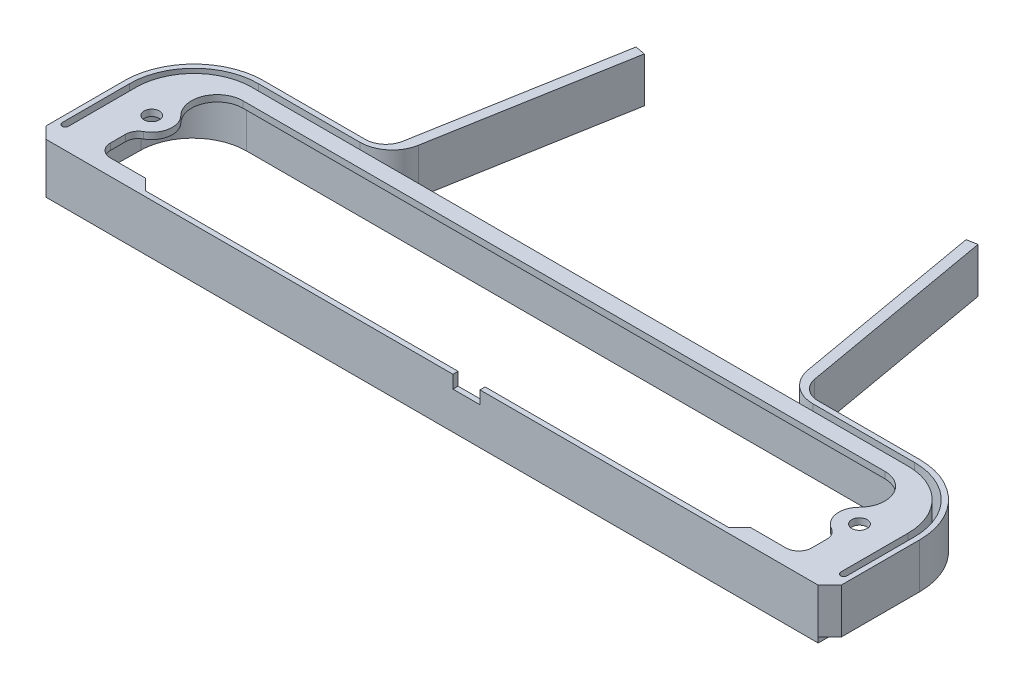
from build123d import *
from build123d.topology import SkipClean

# Parameters (mm, degrees)
SKETCH1_R               = 1.2
BOSS_EXTRUDE1_DEPTH     = 1
BOSS_EXTRUDE2_START     = 7.2
BOSS_EXTRUDE2_DEPTH     = 8.2
CHAMFER1_SIZE           = 1
CUT_EXTRUDE1_DEPTH      = 65.659415401
CUT_EXTRUDE1_DEPTH_BACK = 65.659415401
CUT_EXTRUDE2_REACH      = 66.659
SKETCH11_W              = 4.2
SKETCH11_H              = 2
FILLET1_R               = 2
CHAMFER2_SIZE           = 1.7
BOSS_EXTRUDE3_START     = 1
BOSS_EXTRUDE3_DEPTH     = 7


with BuildPart() as part:
    # Sketch1 → Boss-Extrude1 (new body)
    with BuildSketch(Plane(origin=(0, 0, 0), x_dir=(1, 0, 0), z_dir=(0, 1, 0))):
        with BuildLine():
            Line((-60, 0), (-54.5, 0))
            Line((-54.5, 0), (54.5, 0))
            Line((54.5, 0), (60, 0))
            Line((60, 0), (60, 14))
            ThreePointArc((60, 14), (57.363961031, 20.363961031), (51, 23))
            Line((51, 23), (-51, 23))
            ThreePointArc((-51, 23), (-57.363961031, 20.363961031), (-60, 14))
            Line((-60, 14), (-60, 0))
        make_face()
        with Locations(Location((55, 11.43, 0), (0, 0, 270))):
            Circle(SKETCH1_R, mode=Mode.SUBTRACT)
        with Locations(Location((-55, 11.43, 0), (0, 0, 270))):
            Circle(SKETCH1_R, mode=Mode.SUBTRACT)
        with BuildLine():
            Line((-49.887750006, 20.5), (49.887750006, 20.5))
            ThreePointArc((49.887750006, 20.5), (53.580084408, 18.038397435), (52.727888892, 13.683333333))
            ThreePointArc((52.727888892, 13.683333333), (51.958770192, 10.434549723), (54.5, 8.269303874))
            Line((54.5, 8.269303874), (54.5, 2.5))
            Line((54.5, 2.5), (47, 2.5))
            Line((47, 2.5), (47, 0.8))
            Line((47, 0.8), (-47, 0.8))
            Line((-47, 0.8), (-47, 2.5))
            Line((-47, 2.5), (-54.5, 2.5))
            Line((-54.5, 2.5), (-54.5, 8.269303874))
            ThreePointArc((-54.5, 8.269303874), (-51.958770192, 10.434549723), (-52.727888892, 13.683333333))
            ThreePointArc((-52.727888892, 13.683333333), (-53.580084408, 18.038397435), (-49.887750006, 20.5))
        make_face(mode=Mode.SUBTRACT)
    extrude(amount=BOSS_EXTRUDE1_DEPTH)

    # Sketch8 → Boss-Extrude2 (add)
    with SkipClean():  # the faces are left unmerged after this step: merging them gives an invalid solid
        with BuildSketch(Plane(origin=(0, 0, 0), x_dir=(-1, 0, 0), z_dir=(0, -1, 0)).offset(BOSS_EXTRUDE2_START)):
            with BuildLine():
                Line((60, 0), (60, 14))
                ThreePointArc((60, 14), (57.363961031, 20.363961031), (51, 23))
                Line((51, 23), (-51, 23))
                ThreePointArc((-51, 23), (-57.363961031, 20.363961031), (-60, 14))
                Line((-60, 14), (-60, 0))
                Line((-60, 0), (60, 0))
            make_face()
            with BuildLine():
                Line((-59.2, 0.8), (59.2, 0.8))
                Line((59.2, 0.8), (59.2, 14))
                ThreePointArc((59.2, 14), (56.798275606, 19.798275606), (51, 22.2))
                Line((51, 22.2), (-51, 22.2))
                ThreePointArc((-51, 22.2), (-56.798275606, 19.798275606), (-59.2, 14))
                Line((-59.2, 14), (-59.2, 0.8))
            make_face(mode=Mode.SUBTRACT)
        extrude(amount=-BOSS_EXTRUDE2_DEPTH)
    add(part.part.scale(1), mode=Mode.REPLACE)  # the faces are merged on a copy

    # Chamfer1
    chamfer1_edges = [part.edges().sort_by_distance(p)[0] for p in [
        (-56.798275606, 0, -19.798275606),
        (-59.2, 0, -7.4),
        (0, 0, -22.2),
        (56.798275606, 0, -19.798275606),
        (59.2, 0, -7.4),
        (-53.1, 0, -0.8),
        (53.1, 0, -0.8),
    ]]
    chamfer(chamfer1_edges, length=CHAMFER1_SIZE)

    # Sketch9 → Cut-Extrude1 (cut, two sides: drawn at the far end of the back side and taken through both)
    with BuildSketch(Plane(origin=(0, 0, 0), x_dir=(0, 0, -1), z_dir=(1, 0, 0)).offset(-CUT_EXTRUDE1_DEPTH_BACK)):
        Polygon((-2, -7.2), (23, -7.2), (-2, -6.763623377), align=None)
    extrude(amount=CUT_EXTRUDE1_DEPTH + CUT_EXTRUDE1_DEPTH_BACK, mode=Mode.SUBTRACT)

    # Sketch11 → Cut-Extrude2 (cut, up to next)
    with BuildSketch(Plane.XY, mode=Mode.PRIVATE) as cut_extrude2_sk1:
        with Locations((5.35, 0)):
            Rectangle(SKETCH11_W, SKETCH11_H)
    cut_extrude2_tool1 = extrude(cut_extrude2_sk1.sketch, amount=-CUT_EXTRUDE2_REACH, mode=Mode.PRIVATE) & part.part
    add(cut_extrude2_tool1.solids().sort_by_distance((5.35, 0, 0))[0], mode=Mode.SUBTRACT)

    # Fillet1
    fillet1_edges = [part.edges().sort_by_distance(p)[0] for p in [
        (-54.5, 0.5, -8.269303874),
        (-54.5, 0.5, -2.5),
        (54.5, 0.5, -2.5),
        (54.5, 0.5, -8.269303874),
    ]]
    fillet(fillet1_edges, radius=FILLET1_R)

    # Chamfer2
    # the kernel refuses this chamfer: 1.7 mm, written as the material it adds along each edge
    with BuildSketch(Plane(origin=(-47, -5.37186108, -0.8), x_dir=(0.9996219169112968, 0, 0.02749587661058625), z_dir=(0, 1, 0))) as chamfer2_piece_1_section:
        Polygon((CHAMFER2_SIZE * 0.999621916911, CHAMFER2_SIZE * 0.0274958766106), (-CHAMFER2_SIZE * 0.0274958766106, CHAMFER2_SIZE * 0.999621916911), (0, 0), align=None)
    chamfer2_piece_1 = extrude(amount=6.37186108, mode=Mode.PRIVATE)
    chamfer2_piece_1 = split(chamfer2_piece_1, bisect_by=Plane(origin=(-46.825, 0, -2.15), z_dir=(0, 1, 0)), keep=Keep.TOP, mode=Mode.PRIVATE)
    add(chamfer2_piece_1)
    with BuildSketch(Plane(origin=(-47, -5.37186108, -0.8), x_dir=(0.9996219169112968, 0, 0.02749587661058625), z_dir=(0, 1, 0))) as chamfer2_piece_2_section:
        Polygon((CHAMFER2_SIZE * 0.999621916911, CHAMFER2_SIZE * 0.0274958766106), (-CHAMFER2_SIZE * 0.0274958766106, CHAMFER2_SIZE * 0.999621916911), (0, 0), align=None)
    chamfer2_piece_2 = extrude(amount=10.743722159, mode=Mode.PRIVATE)
    chamfer2_piece_2 = split(chamfer2_piece_2, bisect_by=Plane(origin=(-46.296341463, 0, -1.092682927), z_dir=(0, -1, 0)), keep=Keep.TOP, mode=Mode.PRIVATE)
    chamfer2_piece_2 = split(chamfer2_piece_2, bisect_by=Plane(origin=(-46.296341463, -0.530487805, -1.269512195), z_dir=(0, 0.7071067811865476, 0.7071067811865476)), keep=Keep.TOP, mode=Mode.PRIVATE)
    add(chamfer2_piece_2)
    with BuildSketch(Plane(origin=(47, 1, -0.8), x_dir=(0.02749587661058786, 0, -0.9996219169112968), z_dir=(0, -1, 0))) as chamfer2_piece_3_section:
        Polygon((CHAMFER2_SIZE * 0.999621916911, -CHAMFER2_SIZE * 0.0274958766106), (-CHAMFER2_SIZE * 0.0274958766106, -CHAMFER2_SIZE * 0.999621916911), (0, 0), align=None)
    chamfer2_piece_3 = extrude(amount=6.37186108, mode=Mode.PRIVATE)
    chamfer2_piece_3 = split(chamfer2_piece_3, bisect_by=Plane(origin=(46.417200072, 0.023893659, -1.823893659), z_dir=(0, 0.7071067811865476, 0.7071067811865476)), keep=Keep.TOP, mode=Mode.PRIVATE)
    add(chamfer2_piece_3)
    with BuildSketch(Plane(origin=(47, 5.37186108, -0.8), x_dir=(0.02749587661058786, 0, -0.9996219169112968), z_dir=(0, -1, 0))) as chamfer2_piece_4_section:
        Polygon((CHAMFER2_SIZE * 0.999621916911, -CHAMFER2_SIZE * 0.0274958766106), (-CHAMFER2_SIZE * 0.0274958766106, -CHAMFER2_SIZE * 0.999621916911), (0, 0), align=None)
    chamfer2_piece_4 = extrude(amount=10.743722159, mode=Mode.PRIVATE)
    chamfer2_piece_4 = split(chamfer2_piece_4, bisect_by=Plane(origin=(46.825, 0, -2.15), z_dir=(0, 1, 0)), keep=Keep.TOP, mode=Mode.PRIVATE)
    chamfer2_piece_4 = split(chamfer2_piece_4, bisect_by=Plane(origin=(46.825, 0.2625, -2.0625), z_dir=(0, -0.7071067811865476, -0.7071067811865476)), keep=Keep.TOP, mode=Mode.PRIVATE)
    add(chamfer2_piece_4)

    # Sketch12 → Boss-Extrude3 (add)
    with BuildSketch(Plane(origin=(0, 0, 0), x_dir=(1, 0, 0), z_dir=(0, 1, 0)).offset(BOSS_EXTRUDE3_START)):
        with BuildLine():
            Line((-60, 0), (-61.8, 1.8))
            Line((-61.8, 1.8), (-61.8, 14))
            ThreePointArc((-61.8, 14), (-58.636753237, 21.636753237), (-51, 24.8))
            Line((-51, 24.8), (-35.1906155, 24.8))
            ThreePointArc((-35.1906155, 24.8), (-33.11319707, 25.556118473), (-32.007825811, 27.470677654))
            Line((-32.007825811, 27.470677654), (-26.575692405, 58.277837084))
            Line((-26.575692405, 58.277837084), (-25, 58))
            Line((-25, 58), (-30.266576735, 28.131759112))
            ThreePointArc((-30.266576735, 28.131759112), (-31.976677452, 25.169777784), (-35.1906155, 24))
            Line((-35.1906155, 24), (-51, 24))
            ThreePointArc((-51, 24), (-58.071067812, 21.071067812), (-61, 14))
            Line((-61, 14), (-61, 3.5))
            ThreePointArc((-61, 3.5), (-60.5, 3), (-60, 3.5))
            Line((-60, 3.5), (-60, 0))
        make_face()
    boss_extrude3 = extrude(amount=-BOSS_EXTRUDE3_DEPTH)

    # Mirror2: Boss-Extrude3 across plane
    add(boss_extrude3.mirror(Plane(origin=(0, 0, 0), x_dir=(0, 0, 1), z_dir=(1, 0, 0))))


solid = part.part
